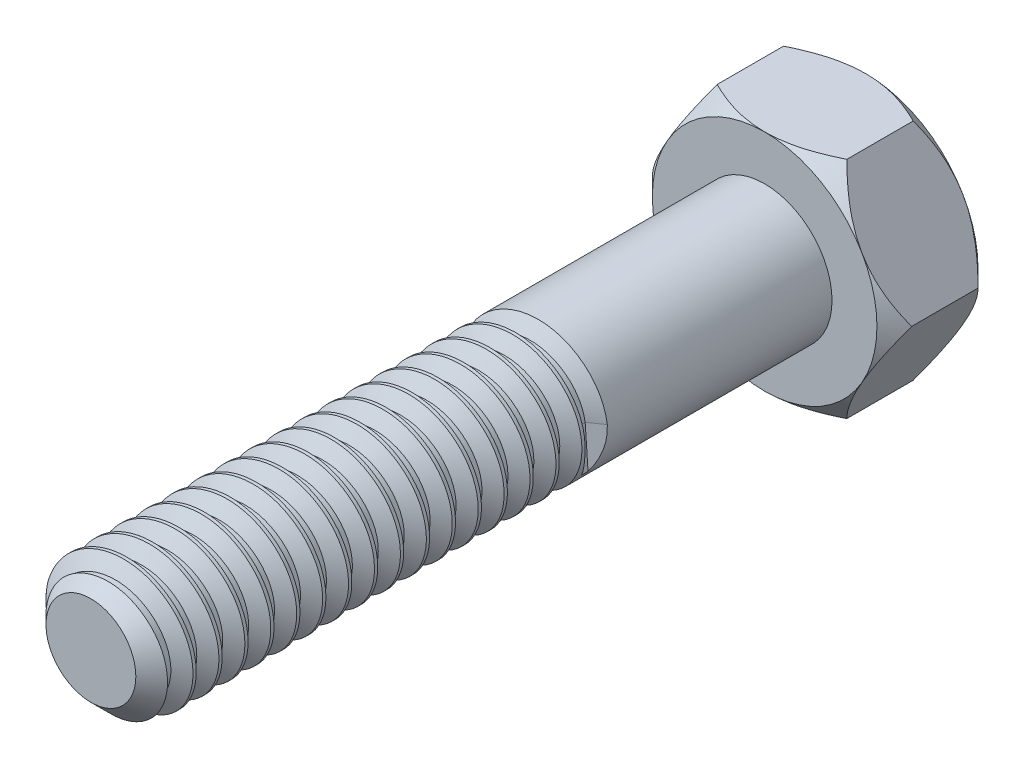
from build123d import *

# Parameters (mm, degrees)
BOSS_EXTRUDE1_DEPTH     = 1.125
SKETCH2_OUTSIDE_W       = 20.232
SKETCH2_OUTSIDE_H       = 19.458
SKETCH2_OUTSIDE_R       = 2.5
CUT_EXTRUDE1_DEPTH      = 5.432362049
CUT_EXTRUDE1_DRAFT      = -45
MIRROR1_COPY_1_SKETCH_W = 20.232
MIRROR1_COPY_1_SKETCH_H = 19.458
MIRROR1_COPY_1_SKETCH_R = 2.5
MIRROR1_COPY_1_DEPTH    = 5.432362049
MIRROR1_COPY_1_DRAFT    = -45
SKETCH3_R               = 1.5
BOSS_EXTRUDE2_DEPTH     = 15
CHAMFER1_SIZE           = 0.5
THREAD1_PITCH           = 0.577272727
CUT_EXTRUDE2_DEPTH      = 17.571027776


with BuildPart() as part:
    # Sketch1 → Boss-Extrude1 (new, symmetric)
    with BuildSketch(Plane.XY):
        Polygon((1.443375673, -2.5), (2.886751346, 0), (1.443375673, 2.5), (-1.443375673, 2.5), (-2.886751346, 0), (-1.443375673, -2.5), align=None)
    extrude(amount=BOSS_EXTRUDE1_DEPTH, both=True)


with BuildPart() as cut_extrude1_tool:
    # Sketch2 outside → Cut-Extrude1 (with draft: the straight prism first)
    with BuildSketch(Plane.XY.offset(1.125)):
        Rectangle(SKETCH2_OUTSIDE_W, SKETCH2_OUTSIDE_H)
        Circle(SKETCH2_OUTSIDE_R, mode=Mode.SUBTRACT)
    extrude(amount=-CUT_EXTRUDE1_DEPTH)
    # Cut-Extrude1: the draft: its side faces are tilted about the plane it starts from
    cut_extrude1_sides = [cut_extrude1_tool.faces().sort_by_distance(p)[0] for p in [
        (0, -9.729, -1.591181024),
        (10.116, 0, -1.591181024),
        (0, 9.729, -1.591181024),
        (-10.116, 0, -1.591181024),
        (-2.5, 0, -1.591181024),
    ]]
    draft(cut_extrude1_sides, Plane.XY.offset(1.125), CUT_EXTRUDE1_DRAFT)


with BuildPart() as part_1:
    add(part.part)

    # Cut-Extrude1: cut by cut_extrude1_tool
    add(cut_extrude1_tool.part, mode=Mode.SUBTRACT)


with BuildPart() as mirror1_copy_1_tool:
    # Mirror1 copy 1 sketch → Mirror1 copy 1 (with draft: the straight prism first)
    with BuildSketch(Plane(origin=(0, 0, -1.125), x_dir=(1, 0, 0), z_dir=(0, 0, -1))):
        Rectangle(MIRROR1_COPY_1_SKETCH_W, MIRROR1_COPY_1_SKETCH_H)
        Circle(MIRROR1_COPY_1_SKETCH_R, mode=Mode.SUBTRACT)
    extrude(amount=-MIRROR1_COPY_1_DEPTH)
    # Mirror1 copy 1: the draft: its side faces are tilted about the plane it starts from
    mirror1_copy_1_sides = [mirror1_copy_1_tool.faces().sort_by_distance(p)[0] for p in [
        (0, -9.729, 1.591181024),
        (10.116, 0, 1.591181024),
        (0, 9.729, 1.591181024),
        (-10.116, 0, 1.591181024),
        (-2.5, 0, 1.591181024),
    ]]
    draft(mirror1_copy_1_sides, Plane(origin=(0, 0, -1.125), x_dir=(1, 0, 0), z_dir=(0, 0, -1)), MIRROR1_COPY_1_DRAFT)


with BuildPart() as part_2:
    add(part_1.part)

    # Mirror1 copy 1: cut by mirror1_copy_1_tool
    add(mirror1_copy_1_tool.part, mode=Mode.SUBTRACT)

    # Sketch3 → Boss-Extrude2 (add)
    with BuildSketch(Plane.XY.offset(1.125)):
        Circle(SKETCH3_R)
    extrude(amount=BOSS_EXTRUDE2_DEPTH)

    # Chamfer1
    chamfer1_edges = [part_2.edges().sort_by_distance(p)[0] for p in [
        (-1.5, 0, 16.125),
    ]]
    chamfer(chamfer1_edges, length=CHAMFER1_SIZE)

    # Thread1: the profile of Thread Profile2 profile screwed along a right-hand helix of 20 turns, 6 arcs to a turn; built about Z, then put on its axis
    thread1_z = Axis((0, 0, 0), (0, 0, 1))
    thread1_corners = [(1.5003, 0, -0.000173205), (1.5003, 0, 0.50528684), (1.187541972, 0, 0.324715908), (1.187541972, 0, 0.180397726)]
    with BuildLine(mode=Mode.PRIVATE) as thread1_profile:
        Line(thread1_corners[0], thread1_corners[1])
        Line(thread1_corners[1], thread1_corners[2])
        Line(thread1_corners[2], thread1_corners[3])
        Line(thread1_corners[3], thread1_corners[0])
    thread1_cap = Face(thread1_profile.wire())
    thread1_turn_angles = [0, 30, 60, 90, 120, 150, 180, 210, 240, 270, 300, 330, 360]
    thread1_turn_weights = [1, 0.8660254037844387, 1, 0.8660254037844387, 1, 0.8660254037844387, 1, 0.8660254037844387, 1, 0.8660254037844387, 1, 0.8660254037844387, 1]
    thread1_turn_rails = [Edge.make_bspline([Vector(p[0], p[1], 0).rotate(thread1_z, thread1_turn_angles[k]) / thread1_turn_weights[k] + Vector(0, 0, p[2] + THREAD1_PITCH * thread1_turn_angles[k] / 360) for k in range(13)], [0, 0, 0, 1, 1, 2, 2, 3, 3, 4, 4, 5, 5, 6, 6, 6], 2, thread1_turn_weights) for p in thread1_corners]
    thread1_turn_sides = [Face.make_surface_from_curves(thread1_turn_rails[p[0]], thread1_turn_rails[p[1]]) for p in [(0, 1), (1, 2), (2, 3), (3, 0)]]
    thread1 = Plane(origin=(0, 0, 6.125), x_dir=(0.99756405, 0.069756474, 0), z_dir=(0, 0, 1)) * Solid(Shell([*[p.moved(Location((0, 0, THREAD1_PITCH * i))) for i in range(20) for p in thread1_turn_sides], thread1_cap, thread1_cap.rotate(thread1_z, 7200).moved(Location((0, 0, THREAD1_PITCH * 7200 / 360)))]))
    add(thread1, mode=Mode.SUBTRACT)

    # Sketch13 → Cut-Extrude2 (cut, through all)
    with BuildSketch(Plane(origin=(0, 0, 0), x_dir=(0.9975640502598243, 0.06975647374412533, 0), z_dir=(-0.06975647374412533, 0.9975640502598243, 0))):
        Polygon((1.5, -6.125), (1.187541972, -6.305397726), (1.187541972, -6.449715908), (1.5, -6.630113635), align=None)
    extrude(amount=-CUT_EXTRUDE2_DEPTH, mode=Mode.SUBTRACT)


solid = part_2.part
